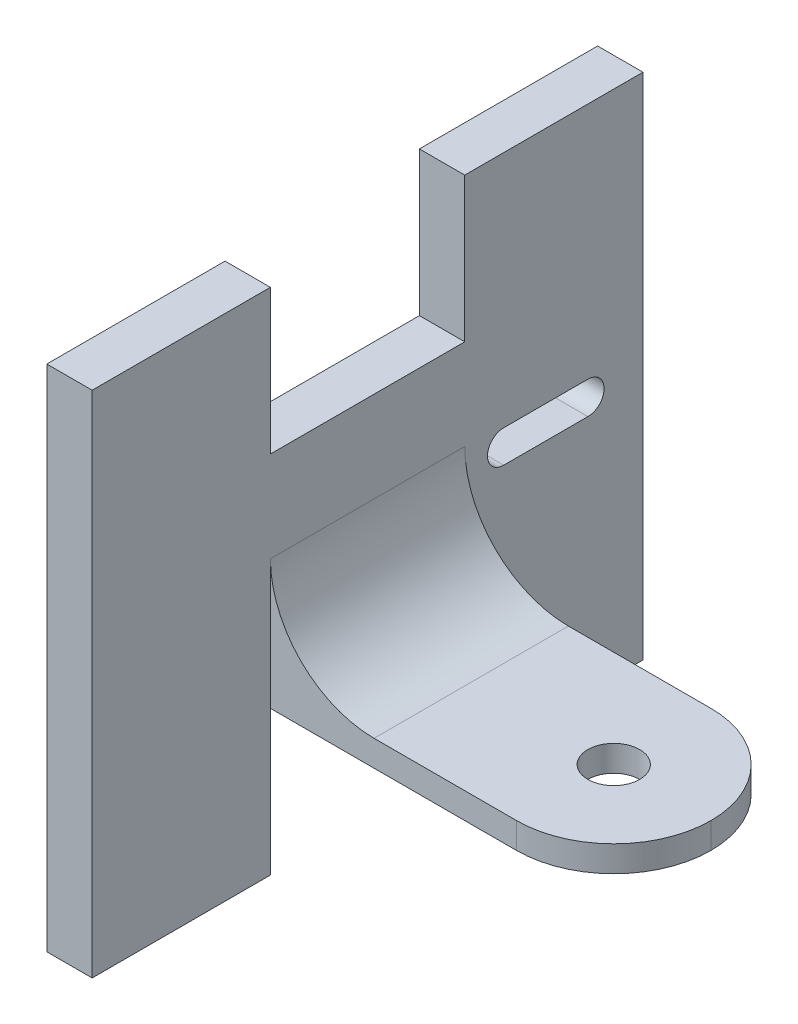
from build123d import *

# Parameters (mm, degrees)
SKETCH_1_W          = 60
SKETCH_1_H          = 30
SKETCH_1_R          = 4
EXTRUDE_1_DEPTH     = 4
SKETCH_2_W          = 7
SKETCH_2_H          = 30
EXTRUDE_2_DEPTH     = 30
SKETCH_4_W          = 7
SKETCH_4_H          = 78.572897546
EXTRUDE_3_DEPTH     = 27.51
FILLET_1_R          = 16
CUT_EXTRUDE_2_DEPTH = 89.228478483
FILLET_2_R          = 15


with BuildPart() as part:
    # 草圖1 → 填料-伸長1 (new body)
    with BuildSketch(Plane(origin=(0, 0, 0), x_dir=(1, 0, 0), z_dir=(0, 1, 0))):
        Rectangle(SKETCH_1_W, SKETCH_1_H)
        with Locations(Location((15, 0, 0), (0, 0, 270))):
            Circle(SKETCH_1_R, mode=Mode.SUBTRACT)
    extrude(amount=EXTRUDE_1_DEPTH)

    # 草圖2 → 填料-伸長2 (add)
    with BuildSketch(Plane(origin=(0, 4, 0), x_dir=(1, 0, 0), z_dir=(0, 1, 0))):
        with Locations((-26.5, 0)):
            Rectangle(SKETCH_2_W, SKETCH_2_H)
    extrude(amount=EXTRUDE_2_DEPTH)

    # 草圖4 → 填料-伸長3 (add)
    with BuildSketch(Plane(origin=(0, 0, -15), x_dir=(-1, 0, 0), z_dir=(0, 0, -1))):
        with Locations((26.5, 17)):
            Rectangle(SKETCH_4_W, SKETCH_4_H)
    extrude_3 = extrude(amount=EXTRUDE_3_DEPTH)

    # 鏡射1: 填料-伸長3 across plane
    add(extrude_3.mirror(Plane.XY))

    # 圓角1
    fillet_1_edges = [part.edges().sort_by_distance(p)[0] for p in [
        (-23, 4, 0),
    ]]
    fillet(fillet_1_edges, radius=FILLET_1_R)

    # 草圖5 → 除料-伸長2 (cut, through all)
    with BuildSketch(Plane(origin=(-23, 0, 0), x_dir=(0, 0, -1), z_dir=(1, 0, 0))):
        with BuildLine():
            Line((21.01, 19.5), (34.01, 19.5))
            ThreePointArc((34.01, 19.5), (36.51, 17), (34.01, 14.5))
            Line((34.01, 14.5), (21.01, 14.5))
            ThreePointArc((21.01, 14.5), (18.51, 17), (21.01, 19.5))
        make_face()
    extrude(amount=-CUT_EXTRUDE_2_DEPTH, mode=Mode.SUBTRACT)

    # 圓角2
    fillet_2_edges = [part.edges().sort_by_distance(p)[0] for p in [
        (30, 2, 15),
        (30, 2, -15),
    ]]
    fillet(fillet_2_edges, radius=FILLET_2_R - 0.0001)  # a hair under: the kernel refuses the full size


solid = part.part
